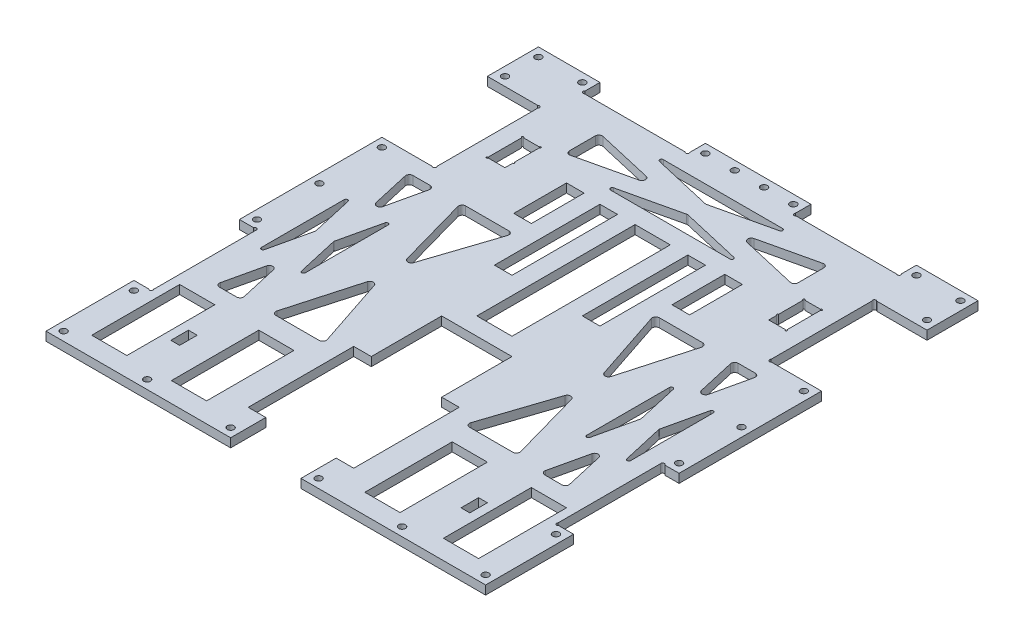
from build123d import *

# Parameters (mm, degrees)
SKETCH1_W           = 317.5
SKETCH1_H           = 355.6
BOSS_EXTRUDE1_DEPTH = 6.35
SKETCH2_W           = 50.8
SKETCH2_H           = 152.4
CUT_EXTRUDE1_DEPTH  = 239.442288615
SKETCH3_W           = 25.4
SKETCH3_H           = 76.2
SKETCH3_W_2         = 12.7
SKETCH3_H_2         = 25.4
CUT_EXTRUDE2_DEPTH  = 239.442288615
SKETCH4_W           = 12.7
SKETCH4_H           = 76.2
SKETCH4_W_2         = 76.2
SKETCH4_H_2         = 12.7
CUT_EXTRUDE3_DEPTH  = 239.442288615
SKETCH5_W           = 25.4
SKETCH5_H           = 63.089423232
SKETCH5_H_2         = 114.3
SKETCH5_W_2         = 12.7
SKETCH5_H_3         = 38.1
SKETCH5_H_4         = 63.5
SKETCH5_W_3         = 6.35
SKETCH5_H_5         = 12.7
CUT_EXTRUDE4_DEPTH  = 239.442288615
SKETCH7_R           = 2.413
CUT_EXTRUDE6_DEPTH  = 239.442288615
SKETCH8_R           = 1.27
SKETCH8_R_2         = 0.635
CUT_EXTRUDE7_DEPTH  = 239.442288615
FILLET1_R           = 1.27
FILLET2_R           = 2.54


with BuildPart() as part:
    # Sketch1 → Boss-Extrude1 (new body)
    with BuildSketch(Plane(origin=(0, 0, 0), x_dir=(1, 0, 0), z_dir=(0, 1, 0))):
        Rectangle(SKETCH1_W, SKETCH1_H)
    extrude(amount=BOSS_EXTRUDE1_DEPTH)

    # Sketch2 → Cut-Extrude1 (cut, through all)
    with BuildSketch(Plane(origin=(0, 6.35, 0), x_dir=(1, 0, 0), z_dir=(0, 1, 0))):
        with Locations((0, -101.6)):
            Rectangle(SKETCH2_W, SKETCH2_H)
    extrude(amount=-CUT_EXTRUDE1_DEPTH, mode=Mode.SUBTRACT)

    # Sketch3 → Cut-Extrude2 (cut, through all)
    with BuildSketch(Plane(origin=(0, 6.35, 0), x_dir=(1, 0, 0), z_dir=(0, 1, 0))):
        with Locations((133.35, 102.87)):
            Rectangle(SKETCH3_W, SKETCH3_H)
        with Locations((101.6, 102.87)):
            Rectangle(SKETCH3_W_2, SKETCH3_H_2)
        with Locations((-101.6, 102.87)):
            Rectangle(SKETCH3_W_2, SKETCH3_H_2)
        with Locations((-133.35, 102.87)):
            Rectangle(SKETCH3_W, SKETCH3_H)
    extrude(amount=-CUT_EXTRUDE2_DEPTH, mode=Mode.SUBTRACT)

    # Sketch4 → Cut-Extrude3 (cut, through all)
    with BuildSketch(Plane(origin=(0, 6.35, 0), x_dir=(1, 0, 0), z_dir=(0, 1, 0))):
        with Locations((-152.4, 102.87)):
            Rectangle(SKETCH4_W, SKETCH4_H)
        with Locations((-152.4, -76.2)):
            Rectangle(SKETCH4_W, SKETCH4_H)
        with Locations((152.4, 102.87)):
            Rectangle(SKETCH4_W, SKETCH4_H)
        with Locations((152.4, -76.2)):
            Rectangle(SKETCH4_W, SKETCH4_H)
        with Locations((76.2, 171.45)):
            Rectangle(SKETCH4_W_2, SKETCH4_H_2)
        with Locations((-76.2, 171.45)):
            Rectangle(SKETCH4_W_2, SKETCH4_H_2)
        with Locations((-31.75, -114.3)):
            Rectangle(SKETCH4_W, SKETCH4_H)
        with Locations((31.75, 63.5)):
            Rectangle(SKETCH4_W, SKETCH4_H)
        with Locations((-31.75, 63.5)):
            Rectangle(SKETCH4_W, SKETCH4_H)
        with Locations((31.75, -114.3)):
            Rectangle(SKETCH4_W, SKETCH4_H)
    extrude(amount=-CUT_EXTRUDE3_DEPTH, mode=Mode.SUBTRACT)

    # Sketch5 → Cut-Extrude4 (cut, through all)
    with BuildSketch(Plane(origin=(0, 6.35, 0), x_dir=(1, 0, 0), z_dir=(0, 1, 0))):
        with Locations((-69.85, -131.874711616)):
            Rectangle(SKETCH5_W, SKETCH5_H)
        Polygon((-117.475, -46.432505999), (-126.838066818, -87.63), (-108.111933182, -87.63), align=None)
        Polygon((-133.35, 23.417494001), (-133.35, -58.977494001), (-123.986933182, -17.78), align=None)
        Polygon((-101.6, 23.417494001), (-110.963066818, -17.78), (-101.6, -58.977494001), align=None)
        Polygon((-126.838066818, 52.07), (-117.475, 10.872505999), (-108.111933182, 52.07), align=None)
        Polygon((0, 126.833110246), (-54.310144398, 114.3), (54.310144398, 114.3), align=None)
        Polygon((-82.55, 145.883110246), (-82.55, 120.816889754), (-28.239855602, 133.35), align=None)
        Polygon((82.55, 145.883110246), (28.239855602, 133.35), (82.55, 120.816889754), align=None)
        Polygon((-54.310144398, 152.4), (0, 139.866889754), (54.310144398, 152.4), align=None)
        with Locations((0, 44.45)):
            Rectangle(SKETCH5_W, SKETCH5_H_2)
        with Locations((-57.15, 83.82)):
            Rectangle(SKETCH5_W_2, SKETCH5_H_3)
        with Locations((57.15, 83.82)):
            Rectangle(SKETCH5_W_2, SKETCH5_H_3)
        with Locations((-127, -132.08)):
            Rectangle(SKETCH5_W, SKETCH5_H_4)
        Polygon((-71.4375, -22.791352996), (-88.9, -84.952705992), (-50.8, -84.952705992), align=None)
        with Locations((-104.775, -132.08)):
            Rectangle(SKETCH5_W_3, SKETCH5_H_5)
        Polygon((-50.8, 52.07), (-88.9, 52.07), (-71.4375, -10.091352996), align=None)
    cut_extrude4 = extrude(amount=-CUT_EXTRUDE4_DEPTH, mode=Mode.SUBTRACT)

    # Mirror1: Cut-Extrude4 across plane
    add(cut_extrude4.mirror(Plane(origin=(0, 0, 0), x_dir=(0, 0, 1), z_dir=(1, 0, 0))), mode=Mode.SUBTRACT)

    # Sketch7 → Cut-Extrude6 (cut, through all)
    with BuildSketch(Plane(origin=(0, 6.35, 0), x_dir=(1, 0, 0), z_dir=(0, 1, 0))):
        with Locations((-152.4, -171.45)):
            Circle(SKETCH7_R)
        with Locations((-152.4, 171.45)):
            Circle(SKETCH7_R)
        with Locations((-120.65, 171.45)):
            Circle(SKETCH7_R)
        with Locations((-152.4, 147.32)):
            Circle(SKETCH7_R)
        with Locations((-31.75, 171.45)):
            Circle(SKETCH7_R)
        with Locations((-10.583333333, 171.45)):
            Circle(SKETCH7_R)
        with Locations((10.583333333, 171.45)):
            Circle(SKETCH7_R)
        with Locations((31.75, 171.45)):
            Circle(SKETCH7_R)
        with Locations((-31.75, -171.45)):
            Circle(SKETCH7_R)
        with Locations((-92.075, -171.45)):
            Circle(SKETCH7_R)
        with Locations((-152.4, -120.65)):
            Circle(SKETCH7_R)
        with Locations((-152.4, -31.75)):
            Circle(SKETCH7_R)
        with Locations((-152.4, 58.42)):
            Circle(SKETCH7_R)
        with Locations((-152.4, 13.335)):
            Circle(SKETCH7_R)
        with Locations((31.75, -171.45)):
            Circle(SKETCH7_R)
        with Locations((152.4, 13.335)):
            Circle(SKETCH7_R)
        with Locations((152.4, 58.42)):
            Circle(SKETCH7_R)
        with Locations((152.4, -31.75)):
            Circle(SKETCH7_R)
        with Locations((152.4, -120.65)):
            Circle(SKETCH7_R)
        with Locations((92.075, -171.45)):
            Circle(SKETCH7_R)
        with Locations((152.4, 147.32)):
            Circle(SKETCH7_R)
        with Locations((120.65, 171.45)):
            Circle(SKETCH7_R)
        with Locations((152.4, 171.45)):
            Circle(SKETCH7_R)
        with Locations((152.4, -171.45)):
            Circle(SKETCH7_R)
    extrude(amount=-CUT_EXTRUDE6_DEPTH, mode=Mode.SUBTRACT)

    # Sketch8 → Cut-Extrude7 (cut, through all)
    with BuildSketch(Plane(origin=(0, 6.35, 0), x_dir=(1, 0, 0), z_dir=(0, 1, 0))):
        with Locations((-39.09938383, 165.88366572)):
            Circle(SKETCH8_R)
        with Locations((-113.539841326, 166.117378391)):
            Circle(SKETCH8_R)
        with Locations((-121.560019166, 140.084130304)):
            Circle(SKETCH8_R)
        with Locations((-121.565556473, 65.650145639)):
            Circle(SKETCH8_R)
        with Locations((-147.253032713, -38.506954901)):
            Circle(SKETCH8_R)
        with Locations((-147.044413998, -113.510037468)):
            Circle(SKETCH8_R)
        with Locations((-107.95, 115.57)):
            Circle(SKETCH8_R_2)
        with Locations((-95.25, 115.57)):
            Circle(SKETCH8_R_2)
        with Locations((-95.25, 96.52)):
            Circle(SKETCH8_R_2)
        with Locations((-107.95, 90.17)):
            Circle(SKETCH8_R_2)
        with Locations((107.95, 90.17)):
            Circle(SKETCH8_R_2)
        with Locations((95.25, 96.52)):
            Circle(SKETCH8_R_2)
        with Locations((95.25, 115.57)):
            Circle(SKETCH8_R_2)
        with Locations((107.95, 115.57)):
            Circle(SKETCH8_R_2)
    cut_extrude7 = extrude(amount=-CUT_EXTRUDE7_DEPTH, mode=Mode.SUBTRACT)

    # Mirror2: Cut-Extrude7 across plane
    add(cut_extrude7.mirror(Plane(origin=(0, 0, 0), x_dir=(0, 0, 1), z_dir=(1, 0, 0))), mode=Mode.SUBTRACT)

    # Fillet1
    fillet1_edges = [part.edges().sort_by_distance(p)[0] for p in [
        (-101.6, 3.175, 58.977494001),
        (-110.963066818, 3.175, 17.78),
        (-101.6, 3.175, -23.417494001),
        (-133.35, 3.175, -23.417494001),
        (-123.986933182, 3.175, 17.78),
        (-133.35, 3.175, 58.977494001),
        (133.35, 3.175, -23.417494001),
        (133.35, 3.175, 58.977494001),
        (123.986933182, 3.175, 17.78),
        (101.6, 3.175, -23.417494001),
        (110.963066818, 3.175, 17.78),
        (101.6, 3.175, 58.977494001),
        (54.310144398, 3.175, -152.4),
        (-54.310144398, 3.175, -152.4),
        (54.310144398, 3.175, -114.3),
        (-54.310144398, 3.175, -114.3),
    ]]
    fillet(fillet1_edges, radius=FILLET1_R)

    # Fillet2
    fillet2_edges = [part.edges().sort_by_distance(p)[0] for p in [
        (-126.838066818, 3.175, 87.63),
        (-108.111933182, 3.175, 87.63),
        (-117.475, 3.175, 46.432505999),
        (-28.239855602, 3.175, -133.35),
        (-82.55, 3.175, -120.816889754),
        (-82.55, 3.175, -145.883110246),
        (-88.9, 3.175, -52.07),
        (-71.4375, 3.175, 10.091352996),
        (-50.8, 3.175, -52.07),
        (-71.4375, 3.175, 22.791352996),
        (-88.9, 3.175, 84.952705992),
        (-50.8, 3.175, 84.952705992),
        (-126.838066818, 3.175, -52.07),
        (-117.475, 3.175, -10.872505999),
        (-108.111933182, 3.175, -52.07),
        (126.838066818, 3.175, 87.63),
        (108.111933182, 3.175, 87.63),
        (117.475, 3.175, 46.432505999),
        (88.9, 3.175, 84.952705992),
        (50.8, 3.175, 84.952705992),
        (71.4375, 3.175, 22.791352996),
        (117.475, 3.175, -10.872505999),
        (108.111933182, 3.175, -52.07),
        (126.838066818, 3.175, -52.07),
        (71.4375, 3.175, 10.091352996),
        (88.9, 3.175, -52.07),
        (50.8, 3.175, -52.07),
        (28.239855602, 3.175, -133.35),
        (82.55, 3.175, -120.816889754),
        (82.55, 3.175, -145.883110246),
        (0, 3.175, -139.866889754),
        (0, 3.175, -126.833110246),
    ]]
    fillet(fillet2_edges, radius=FILLET2_R)


solid = part.part
